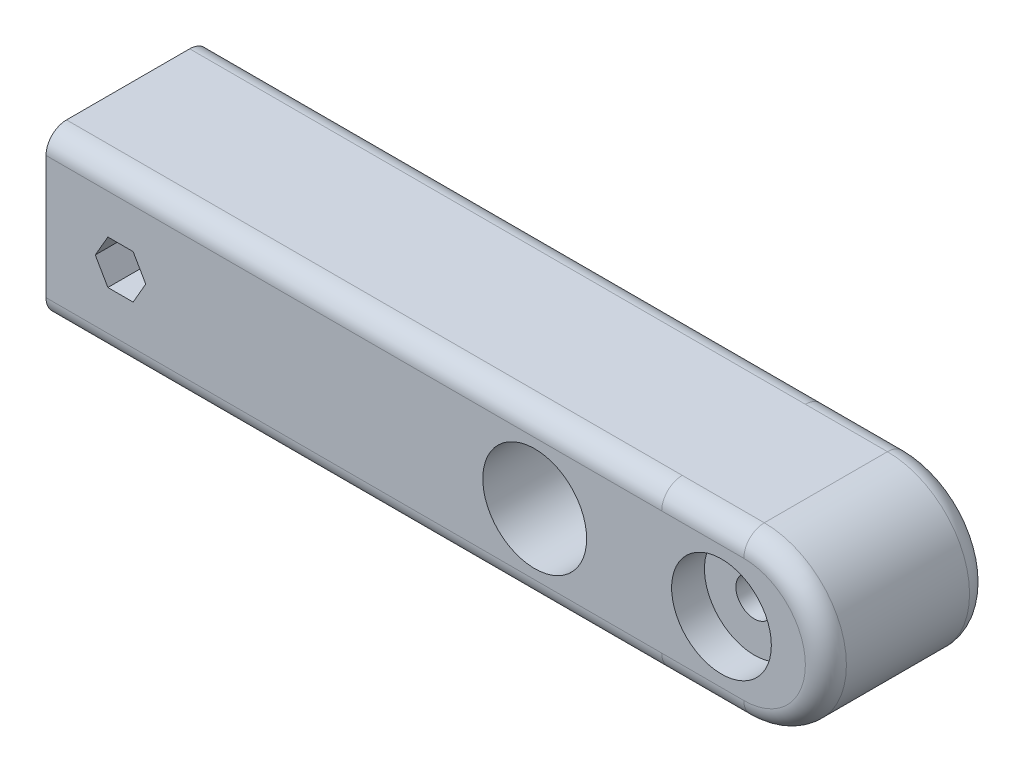
from build123d import *

# Parameters (mm, degrees)
CROQUIS1_W              = 150
CROQUIS1_H              = 40
SALIENTE_EXTRUIR1_DEPTH = 40
REDONDEO2_R             = 5
REDONDEO3_R             = 5
CORTAR_EXTRUIR2_DEPTH   = 86
CROQUIS7_R              = 12.65
CORTAR_EXTRUIR4_DEPTH   = 72
SALIENTE_EXTRUIR2_DEPTH = 40
REDONDEO4_R             = 5
CROQUIS10_R             = 4.5
CORTAR_EXTRUIR5_DEPTH   = 60
CROQUIS12_R             = 12.15
CORTAR_EXTRUIR6_DEPTH   = 8
CORTAR_EXTRUIR7_START   = -8
CROQUIS13_R             = 12.15
CORTAR_EXTRUIR7_DEPTH   = 8
CROQUIS14_R             = 12.15
CORTAR_EXTRUIR8_DEPTH   = 8


with BuildPart() as part:
    # Croquis1 → Saliente-Extruir1 (new body)
    with BuildSketch(Plane(origin=(0, 0, 0), x_dir=(1, 0, 0), z_dir=(0, 1, 0))):
        with Locations((75, -20)):
            Rectangle(CROQUIS1_W, CROQUIS1_H)
    extrude(amount=SALIENTE_EXTRUIR1_DEPTH)

    # Redondeo2
    redondeo2_edges = [part.edges().sort_by_distance(p)[0] for p in [
        (75, 0, 0),
    ]]
    fillet(redondeo2_edges, radius=REDONDEO2_R)

    # Redondeo3
    redondeo3_edges = [part.edges().sort_by_distance(p)[0] for p in [
        (75, 40, 0),
        (75, 40, 40),
        (75, 0, 40),
    ]]
    fillet(redondeo3_edges, radius=REDONDEO3_R)

    # Croquis6 → Cortar-Extruir2 (cut)
    with BuildSketch(Plane(origin=(0, 0, 0), x_dir=(-1, 0, 0), z_dir=(0, 0, -1))):
        Polygon((-15.075, 14.673943767), (-12, 20), (-15.075, 25.326056233), (-21.225, 25.326056233), (-24.3, 20), (-21.225, 14.673943767), align=None)
    extrude(amount=-CORTAR_EXTRUIR2_DEPTH, mode=Mode.SUBTRACT)

    # Croquis7 → Cortar-Extruir4 (cut)
    with BuildSketch(Plane.XY.offset(40)):
        with Locations((119.05843723, 20)):
            Circle(CROQUIS7_R)
    extrude(amount=-CORTAR_EXTRUIR4_DEPTH, mode=Mode.SUBTRACT)

    # Croquis9 → Saliente-Extruir2 (add)
    with BuildSketch(Plane.XY.offset(40)):
        with BuildLine():
            Line((150, 40), (170, 40))
            ThreePointArc((170, 40), (190, 20), (170, 0))
            Line((170, 0), (150, 0))
            Line((150, 0), (150, 40))
        make_face()
    extrude(amount=-SALIENTE_EXTRUIR2_DEPTH)

    # Redondeo4
    redondeo4_edges = [part.edges().sort_by_distance(p)[0] for p in [
        (160, 40, 0),
        (190, 20, 0),
        (160, 0, 0),
        (160, 40, 40),
        (190, 20, 40),
        (160, 0, 40),
    ]]
    fillet(redondeo4_edges, radius=REDONDEO4_R)

    # Croquis10 → Cortar-Extruir5 (cut)
    with BuildSketch(Plane.XY.offset(40)):
        with Locations((164.56347457, 20)):
            Circle(CROQUIS10_R)
    extrude(amount=-CORTAR_EXTRUIR5_DEPTH, mode=Mode.SUBTRACT)

    # Croquis12 → Cortar-Extruir6 (cut)
    with BuildSketch(Plane.XY.offset(40)):
        with Locations((164.56347457, 20)):
            Circle(CROQUIS12_R)
    extrude(amount=-CORTAR_EXTRUIR6_DEPTH, mode=Mode.SUBTRACT)

    # Croquis13 → Cortar-Extruir7 (cut)
    with BuildSketch(Plane(origin=(0, 0, 0), x_dir=(-1, 0, 0), z_dir=(0, 0, -1)).offset(CORTAR_EXTRUIR7_START)):
        with Locations((-164.56347457, 20)):
            Circle(CROQUIS13_R)
    extrude(amount=CORTAR_EXTRUIR7_DEPTH, mode=Mode.SUBTRACT)

    # Croquis14 → Cortar-Extruir8 (cut)
    with BuildSketch(Plane(origin=(0, 0, 0), x_dir=(-1, 0, 0), z_dir=(0, 0, -1))):
        with Locations((-18.209933634, 19.940768986)):
            Circle(CROQUIS14_R)
    extrude(amount=-CORTAR_EXTRUIR8_DEPTH, mode=Mode.SUBTRACT)


solid = part.part
